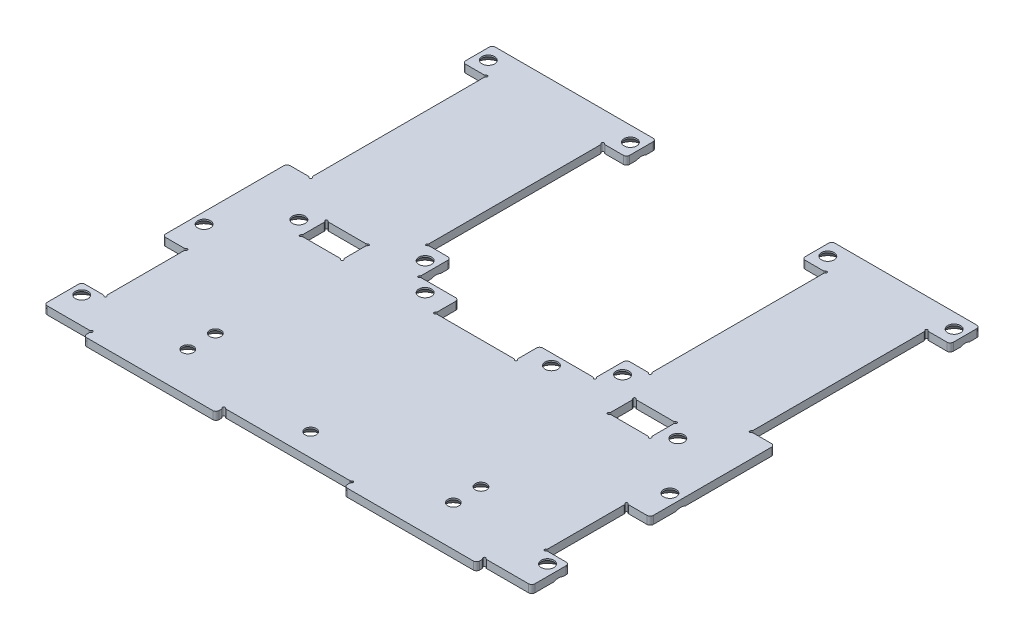
from build123d import *

# Parameters (mm, degrees)
STOCK_HAMMERSAW_START                   = 9.525
STOCK_HAMMERSAW_MULTIBODY_1_OUTLINE_R   = 2.5527
STOCK_HAMMERSAW_MULTIBODY_1_OUTLINE_R_2 = 2.2479
STOCK_HAMMERSAW_MULTIBODY_1_OUTLINE_W   = 15.875
STOCK_HAMMERSAW_MULTIBODY_1_OUTLINE_H   = 9.525
STOCK_HAMMERSAW_MULTIBODY_1_DEPTH       = 3.175
SKETCH1_W                               = 16.637
SKETCH1_H                               = 10.287
SKETCH1_W_2                             = 15.875
SKETCH1_H_2                             = 9.525
CUT_EXTRUDE1_DEPTH                      = 190.518513278
SKETCH2_R                               = 0.47625
CUT_EXTRUDE2_DEPTH                      = 189.995159983
FILLET1_R                               = 0.635
FILLET2_R                               = 1.27
CHAMFER1_SIZE                           = 2.207988314
CHAMFER1_SIZE_2                         = 2.54


# Read off the part's stored shape, not the designer's step: Stock-HammerSaw Multibody-1
with BuildPart() as part:
    # Stock-HammerSaw Multibody-1 outline → Stock-HammerSaw Multibody-1 (new body)
    with BuildSketch(Plane(origin=(0, 0, 0), x_dir=(1, 0, 0), z_dir=(0, 1, 0)).offset(STOCK_HAMMERSAW_START)):
        Polygon((38.1, 66.675), (15.875, 66.675), (15.875, 57.15), (-15.875, 57.15), (-15.875, 66.675), (-31.75, 66.675), (-31.75, 79.375), (-41.275, 79.375), (-41.275, 149.225), (-31.75, 149.225), (-31.75, 161.925), (-98.425, 161.925), (-98.425, 149.225), (-88.9, 149.225), (-88.9, 79.375), (-98.425, 79.375), (-98.425, 28.575), (-88.9, 28.575), (-88.9, -3.175), (-98.425, -3.175), (-98.425, -19.05), (-79.375, -19.05), (-79.375, -22.225), (-25.4, -22.225), (-25.4, -19.05), (25.4, -19.05), (25.4, -22.225), (79.375, -22.225), (79.375, -19.05), (98.425, -19.05), (98.425, -3.175), (88.9, -3.175), (88.9, 28.575), (98.425, 28.575), (98.425, 79.375), (88.9, 79.375), (88.9, 149.225), (98.425, 149.225), (98.425, 161.925), (38.1, 161.925), (38.1, 149.225), (47.625, 149.225), (47.625, 79.375), (38.1, 79.375), align=None)
        with Locations((-93.6625, -7.9375)):
            Circle(STOCK_HAMMERSAW_MULTIBODY_1_OUTLINE_R, mode=Mode.SUBTRACT)
        with Locations((-53.4035, -5.55244)):
            Circle(STOCK_HAMMERSAW_MULTIBODY_1_OUTLINE_R_2, mode=Mode.SUBTRACT)
        with Locations((-53.4035, 5.55244)):
            Circle(STOCK_HAMMERSAW_MULTIBODY_1_OUTLINE_R_2, mode=Mode.SUBTRACT)
        with Locations((-93.6625, 41.275)):
            Circle(STOCK_HAMMERSAW_MULTIBODY_1_OUTLINE_R, mode=Mode.SUBTRACT)
        with Locations((-76.2, 61.9125)):
            Circle(STOCK_HAMMERSAW_MULTIBODY_1_OUTLINE_R, mode=Mode.SUBTRACT)
        with Locations((-61.9125, 61.9125)):
            Rectangle(STOCK_HAMMERSAW_MULTIBODY_1_OUTLINE_W, STOCK_HAMMERSAW_MULTIBODY_1_OUTLINE_H, mode=Mode.SUBTRACT)
        with Locations((-25.4, 61.9125)):
            Circle(STOCK_HAMMERSAW_MULTIBODY_1_OUTLINE_R, mode=Mode.SUBTRACT)
        with Locations((0, -9.525)):
            Circle(STOCK_HAMMERSAW_MULTIBODY_1_OUTLINE_R_2, mode=Mode.SUBTRACT)
        with Locations((53.4035, -5.55244)):
            Circle(STOCK_HAMMERSAW_MULTIBODY_1_OUTLINE_R_2, mode=Mode.SUBTRACT)
        with Locations((93.6625, -7.9375)):
            Circle(STOCK_HAMMERSAW_MULTIBODY_1_OUTLINE_R, mode=Mode.SUBTRACT)
        with Locations((53.4035, 5.55244)):
            Circle(STOCK_HAMMERSAW_MULTIBODY_1_OUTLINE_R_2, mode=Mode.SUBTRACT)
        with Locations((25.4, 61.9125)):
            Circle(STOCK_HAMMERSAW_MULTIBODY_1_OUTLINE_R, mode=Mode.SUBTRACT)
        with Locations((93.6625, 41.275)):
            Circle(STOCK_HAMMERSAW_MULTIBODY_1_OUTLINE_R, mode=Mode.SUBTRACT)
        with Locations((61.9125, 61.9125)):
            Rectangle(STOCK_HAMMERSAW_MULTIBODY_1_OUTLINE_W, STOCK_HAMMERSAW_MULTIBODY_1_OUTLINE_H, mode=Mode.SUBTRACT)
        with Locations((76.2, 61.9125)):
            Circle(STOCK_HAMMERSAW_MULTIBODY_1_OUTLINE_R, mode=Mode.SUBTRACT)
        with Locations((-36.5125, 73.025)):
            Circle(STOCK_HAMMERSAW_MULTIBODY_1_OUTLINE_R, mode=Mode.SUBTRACT)
        with Locations((-93.6625, 155.575)):
            Circle(STOCK_HAMMERSAW_MULTIBODY_1_OUTLINE_R, mode=Mode.SUBTRACT)
        with Locations((-36.5125, 155.575)):
            Circle(STOCK_HAMMERSAW_MULTIBODY_1_OUTLINE_R, mode=Mode.SUBTRACT)
        with Locations((42.8625, 73.025)):
            Circle(STOCK_HAMMERSAW_MULTIBODY_1_OUTLINE_R, mode=Mode.SUBTRACT)
        with Locations((42.8625, 155.575)):
            Circle(STOCK_HAMMERSAW_MULTIBODY_1_OUTLINE_R, mode=Mode.SUBTRACT)
        with Locations((93.6625, 155.575)):
            Circle(STOCK_HAMMERSAW_MULTIBODY_1_OUTLINE_R, mode=Mode.SUBTRACT)
    extrude(amount=STOCK_HAMMERSAW_MULTIBODY_1_DEPTH)

    # Sketch1 → Cut-Extrude1 (cut, through all)
    # profile 1 of 3: a face of its own
    with BuildSketch(Plane(origin=(0, 12.7, 0), x_dir=(1, 0, 0), z_dir=(0, 1, 0))):
        Polygon((38.1, 66.675), (15.875, 66.675), (15.875, 57.15), (-15.875, 57.15), (-15.875, 66.675), (-31.75, 66.675), (-31.75, 79.375), (-41.275, 79.375), (-41.275, 149.225), (-31.75, 149.225), (-31.75, 161.925), (-98.425, 161.925), (-98.425, 149.225), (-88.9, 149.225), (-88.9, 79.375), (-98.425, 79.375), (-98.425, 28.575), (-88.9, 28.575), (-88.9, -3.175), (-98.425, -3.175), (-98.425, -19.05), (-79.375, -19.05), (-79.375, -22.225), (-25.4, -22.225), (-25.4, -19.05), (25.4, -19.05), (25.4, -22.225), (79.375, -22.225), (79.375, -19.05), (98.425, -19.05), (98.425, -3.175), (88.9, -3.175), (88.9, 28.575), (98.425, 28.575), (98.425, 79.375), (88.9, 79.375), (88.9, 149.225), (98.425, 149.225), (98.425, 161.925), (38.1, 161.925), (38.1, 149.225), (47.625, 149.225), (47.625, 79.375), (38.1, 79.375), align=None)
        Polygon((38.481, 66.294), (16.256, 66.294), (16.256, 56.769), (-16.256, 56.769), (-16.256, 66.294), (-32.131, 66.294), (-32.131, 78.994), (-41.656, 78.994), (-41.656, 149.606), (-32.131, 149.606), (-32.131, 161.544), (-98.044, 161.544), (-98.044, 149.606), (-88.519, 149.606), (-88.519, 78.994), (-98.044, 78.994), (-98.044, 28.956), (-88.519, 28.956), (-88.519, -3.556), (-98.044, -3.556), (-98.044, -18.669), (-78.994, -18.669), (-78.994, -21.844), (-25.781, -21.844), (-25.781, -18.669), (25.781, -18.669), (25.781, -21.844), (78.994, -21.844), (78.994, -18.669), (98.044, -18.669), (98.044, -3.556), (88.519, -3.556), (88.519, 28.956), (98.044, 28.956), (98.044, 78.994), (88.519, 78.994), (88.519, 149.606), (98.044, 149.606), (98.044, 161.544), (38.481, 161.544), (38.481, 149.606), (48.006, 149.606), (48.006, 78.994), (38.481, 78.994), align=None, mode=Mode.SUBTRACT)
    # profile 2 of 3: a face of its own
    with BuildSketch(Plane(origin=(0, 12.7, 0), x_dir=(1, 0, 0), z_dir=(0, 1, 0))):
        with Locations((-61.9125, 61.9125)):
            Rectangle(SKETCH1_W, SKETCH1_H)
        with Locations((-61.9125, 61.9125)):
            Rectangle(SKETCH1_W_2, SKETCH1_H_2, mode=Mode.SUBTRACT)
    # profile 3 of 3: a face of its own
    with BuildSketch(Plane(origin=(0, 12.7, 0), x_dir=(1, 0, 0), z_dir=(0, 1, 0))):
        with Locations((61.9125, 61.9125)):
            Rectangle(SKETCH1_W, SKETCH1_H)
        with Locations((61.9125, 61.9125)):
            Rectangle(SKETCH1_W_2, SKETCH1_H_2, mode=Mode.SUBTRACT)
    extrude(amount=-CUT_EXTRUDE1_DEPTH, mode=Mode.SUBTRACT)

    # Sketch2 → Cut-Extrude2 (cut, through all)
    with BuildSketch(Plane(origin=(0, 12.7, 0), x_dir=(1, 0, 0), z_dir=(0, 1, 0))):
        with Locations((-88.519, 149.606)):
            Circle(SKETCH2_R)
        with Locations((-41.656, 149.606)):
            Circle(SKETCH2_R)
        with Locations((-41.656, 78.994)):
            Circle(SKETCH2_R)
        with Locations((-32.131, 66.294)):
            Circle(SKETCH2_R)
        with Locations((-16.256, 56.769)):
            Circle(SKETCH2_R)
        with Locations((-88.519, 78.994)):
            Circle(SKETCH2_R)
        with Locations((-88.519, 28.956)):
            Circle(SKETCH2_R)
        with Locations((-88.519, -3.556)):
            Circle(SKETCH2_R)
        with Locations((-78.994, -18.669)):
            Circle(SKETCH2_R)
        with Locations((-25.781, -18.669)):
            Circle(SKETCH2_R)
        with Locations((25.781, -18.669)):
            Circle(SKETCH2_R)
        with Locations((78.994, -18.669)):
            Circle(SKETCH2_R)
        with Locations((88.519, -3.556)):
            Circle(SKETCH2_R)
        with Locations((88.519, 28.956)):
            Circle(SKETCH2_R)
        with Locations((88.519, 78.994)):
            Circle(SKETCH2_R)
        with Locations((48.006, 78.994)):
            Circle(SKETCH2_R)
        with Locations((38.481, 66.294)):
            Circle(SKETCH2_R)
        with Locations((16.256, 56.769)):
            Circle(SKETCH2_R)
        with Locations((48.006, 149.606)):
            Circle(SKETCH2_R)
        with Locations((88.519, 149.606)):
            Circle(SKETCH2_R)
        with Locations((70.231, 67.056)):
            Circle(SKETCH2_R)
        with Locations((70.231, 56.769)):
            Circle(SKETCH2_R)
        with Locations((53.594, 56.769)):
            Circle(SKETCH2_R)
        with Locations((53.594, 67.056)):
            Circle(SKETCH2_R)
        with Locations((-53.594, 56.769)):
            Circle(SKETCH2_R)
        with Locations((-53.594, 67.056)):
            Circle(SKETCH2_R)
        with Locations((-70.231, 67.056)):
            Circle(SKETCH2_R)
        with Locations((-70.231, 56.769)):
            Circle(SKETCH2_R)
    extrude(amount=-CUT_EXTRUDE2_DEPTH, mode=Mode.SUBTRACT)

    # Fillet1
    fillet1_edges = [part.edges().sort_by_distance(p)[0] for p in [
        (-79.47025, 11.1125, 18.669),
        (-88.519, 11.1125, 3.07975),
        (-88.99525, 11.1125, -28.956),
        (-88.519, 11.1125, -79.47025),
        (-15.77975, 11.1125, -56.769),
        (-31.65475, 11.1125, -66.294),
        (-41.17975, 11.1125, -78.994),
        (-41.656, 11.1125, -149.12975),
        (-69.75475, 11.1125, -56.769),
        (-70.231, 11.1125, -66.57975),
        (-54.07025, 11.1125, -67.056),
        (16.256, 11.1125, -57.24525),
        (47.52975, 11.1125, -149.606),
        (88.519, 11.1125, -149.12975),
        (69.75475, 11.1125, -67.056),
        (-54.07025, 11.1125, -56.769),
        (54.07025, 11.1125, -67.056),
        (54.07025, 11.1125, -56.769),
        (70.231, 11.1125, -57.24525),
        (-88.99525, 11.1125, -149.606),
        (53.594, 11.1125, -57.24525),
        (53.594, 11.1125, -66.57975),
        (69.75475, 11.1125, -56.769),
        (70.231, 11.1125, -66.57975),
        (-53.594, 11.1125, -57.24525),
        (-53.594, 11.1125, -66.57975),
        (-69.75475, 11.1125, -67.056),
        (-70.231, 11.1125, -57.24525),
        (47.52975, 11.1125, -78.994),
        (48.006, 11.1125, -149.12975),
        (88.99525, 11.1125, -149.606),
        (88.519, 11.1125, -79.47025),
        (88.99525, 11.1125, -28.956),
        (88.519, 11.1125, 3.07975),
        (79.47025, 11.1125, 18.669),
        (25.781, 11.1125, 19.14525),
        (-25.30475, 11.1125, 18.669),
        (-78.994, 11.1125, 19.14525),
        (-88.99525, 11.1125, 3.556),
        (-88.519, 11.1125, -28.47975),
        (-88.99525, 11.1125, -78.994),
        (-88.519, 11.1125, -149.12975),
        (-41.17975, 11.1125, -149.606),
        (-41.656, 11.1125, -79.47025),
        (-32.131, 11.1125, -66.77025),
        (-16.256, 11.1125, -57.24525),
        (15.77975, 11.1125, -56.769),
        (38.00475, 11.1125, -66.294),
        (38.481, 11.1125, -66.77025),
        (48.006, 11.1125, -79.47025),
        (88.99525, 11.1125, -78.994),
        (88.519, 11.1125, -28.47975),
        (88.99525, 11.1125, 3.556),
        (78.994, 11.1125, 19.14525),
        (25.30475, 11.1125, 18.669),
        (-25.781, 11.1125, 19.14525),
    ]]
    fillet(fillet1_edges, radius=FILLET1_R)

    # Fillet2
    fillet2_edges = [part.edges().sort_by_distance(p)[0] for p in [
        (38.481, 11.1125, -78.994),
        (16.256, 11.1125, -66.294),
        (-16.256, 11.1125, -66.294),
        (-32.131, 11.1125, -78.994),
        (-32.131, 11.1125, -149.606),
        (-32.131, 11.1125, -161.544),
        (-98.044, 11.1125, -161.544),
        (-98.044, 11.1125, -149.606),
        (-98.044, 11.1125, -78.994),
        (-98.044, 11.1125, -28.956),
        (-98.044, 11.1125, 3.556),
        (-98.044, 11.1125, 18.669),
        (-78.994, 11.1125, 21.844),
        (-25.781, 11.1125, 21.844),
        (25.781, 11.1125, 21.844),
        (78.994, 11.1125, 21.844),
        (98.044, 11.1125, 18.669),
        (98.044, 11.1125, 3.556),
        (98.044, 11.1125, -28.956),
        (98.044, 11.1125, -78.994),
        (98.044, 11.1125, -149.606),
        (98.044, 11.1125, -161.544),
        (38.481, 11.1125, -161.544),
        (38.481, 11.1125, -149.606),
    ]]
    fillet(fillet2_edges, radius=FILLET2_R)

    # Chamfer1
    # the kernel refuses this chamfer: 2.54, 2.207988314 mm, written as the material it takes off along each edge
    with BuildSketch(Plane(origin=(-93.6625, 9.525, -41.275), x_dir=(1, 0, 0), z_dir=(0, 0, 1))) as chamfer1_piece_1:
        Polygon((2.5527 + CHAMFER1_SIZE, 0), (2.5527, CHAMFER1_SIZE_2), (2.5527, 0), align=None)
    revolve(axis=Axis((-93.6625, 9.525, -41.275), (0, 1, 0)), mode=Mode.SUBTRACT)
    with BuildSketch(Plane(origin=(-93.6625, 9.525, 7.9375), x_dir=(1, 0, 0), z_dir=(0, 0, 1))) as chamfer1_piece_2:
        Polygon((2.5527 + CHAMFER1_SIZE, 0), (2.5527, CHAMFER1_SIZE_2), (2.5527, 0), align=None)
    revolve(axis=Axis((-93.6625, 9.525, 7.9375), (0, 1, 0)), mode=Mode.SUBTRACT)
    with BuildSketch(Plane(origin=(-53.4035, 9.525, 5.55244), x_dir=(1, 0, 0), z_dir=(0, 0, 1))) as chamfer1_piece_3:
        Polygon((2.2479 + CHAMFER1_SIZE, 0), (2.2479, CHAMFER1_SIZE_2), (2.2479, 0), align=None)
    revolve(axis=Axis((-53.4035, 9.525, 5.55244), (0, 1, 0)), mode=Mode.SUBTRACT)
    with BuildSketch(Plane(origin=(-53.4035, 9.525, -5.55244), x_dir=(1, 0, 0), z_dir=(0, 0, 1))) as chamfer1_piece_4:
        Polygon((2.2479 + CHAMFER1_SIZE, 0), (2.2479, CHAMFER1_SIZE_2), (2.2479, 0), align=None)
    revolve(axis=Axis((-53.4035, 9.525, -5.55244), (0, 1, 0)), mode=Mode.SUBTRACT)
    with BuildSketch(Plane(origin=(53.4035, 9.525, 5.55244), x_dir=(1, 0, 0), z_dir=(0, 0, 1))) as chamfer1_piece_5:
        Polygon((2.2479 + CHAMFER1_SIZE, 0), (2.2479, CHAMFER1_SIZE_2), (2.2479, 0), align=None)
    revolve(axis=Axis((53.4035, 9.525, 5.55244), (0, 1, 0)), mode=Mode.SUBTRACT)
    with BuildSketch(Plane(origin=(53.4035, 9.525, -5.55244), x_dir=(1, 0, 0), z_dir=(0, 0, 1))) as chamfer1_piece_6:
        Polygon((2.2479 + CHAMFER1_SIZE, 0), (2.2479, CHAMFER1_SIZE_2), (2.2479, 0), align=None)
    revolve(axis=Axis((53.4035, 9.525, -5.55244), (0, 1, 0)), mode=Mode.SUBTRACT)
    with BuildSketch(Plane(origin=(93.6625, 9.525, -41.275), x_dir=(1, 0, 0), z_dir=(0, 0, 1))) as chamfer1_piece_7:
        Polygon((2.5527 + CHAMFER1_SIZE, 0), (2.5527, CHAMFER1_SIZE_2), (2.5527, 0), align=None)
    revolve(axis=Axis((93.6625, 9.525, -41.275), (0, 1, 0)), mode=Mode.SUBTRACT)
    with BuildSketch(Plane(origin=(-76.2, 9.525, -61.9125), x_dir=(1, 0, 0), z_dir=(0, 0, 1))) as chamfer1_piece_8:
        Polygon((2.5527 + CHAMFER1_SIZE, 0), (2.5527, CHAMFER1_SIZE_2), (2.5527, 0), align=None)
    revolve(axis=Axis((-76.2, 9.525, -61.9125), (0, 1, 0)), mode=Mode.SUBTRACT)
    with BuildSketch(Plane(origin=(42.8625, 9.525, -155.575), x_dir=(1, 0, 0), z_dir=(0, 0, 1))) as chamfer1_piece_9:
        Polygon((2.5527 + CHAMFER1_SIZE, 0), (2.5527, CHAMFER1_SIZE_2), (2.5527, 0), align=None)
    revolve(axis=Axis((42.8625, 9.525, -155.575), (0, 1, 0)), mode=Mode.SUBTRACT)
    with BuildSketch(Plane(origin=(-36.5125, 9.525, -155.575), x_dir=(1, 0, 0), z_dir=(0, 0, 1))) as chamfer1_piece_10:
        Polygon((2.5527 + CHAMFER1_SIZE, 0), (2.5527, CHAMFER1_SIZE_2), (2.5527, 0), align=None)
    revolve(axis=Axis((-36.5125, 9.525, -155.575), (0, 1, 0)), mode=Mode.SUBTRACT)
    with BuildSketch(Plane(origin=(-93.6625, 9.525, -155.575), x_dir=(1, 0, 0), z_dir=(0, 0, 1))) as chamfer1_piece_11:
        Polygon((2.5527 + CHAMFER1_SIZE, 0), (2.5527, CHAMFER1_SIZE_2), (2.5527, 0), align=None)
    revolve(axis=Axis((-93.6625, 9.525, -155.575), (0, 1, 0)), mode=Mode.SUBTRACT)
    with BuildSketch(Plane(origin=(-25.4, 9.525, -61.9125), x_dir=(1, 0, 0), z_dir=(0, 0, 1))) as chamfer1_piece_12:
        Polygon((2.5527 + CHAMFER1_SIZE, 0), (2.5527, CHAMFER1_SIZE_2), (2.5527, 0), align=None)
    revolve(axis=Axis((-25.4, 9.525, -61.9125), (0, 1, 0)), mode=Mode.SUBTRACT)
    with BuildSketch(Plane(origin=(93.6625, 9.525, 7.9375), x_dir=(1, 0, 0), z_dir=(0, 0, 1))) as chamfer1_piece_13:
        Polygon((2.5527 + CHAMFER1_SIZE, 0), (2.5527, CHAMFER1_SIZE_2), (2.5527, 0), align=None)
    revolve(axis=Axis((93.6625, 9.525, 7.9375), (0, 1, 0)), mode=Mode.SUBTRACT)
    with BuildSketch(Plane(origin=(42.8625, 9.525, -73.025), x_dir=(1, 0, 0), z_dir=(0, 0, 1))) as chamfer1_piece_14:
        Polygon((2.5527 + CHAMFER1_SIZE, 0), (2.5527, CHAMFER1_SIZE_2), (2.5527, 0), align=None)
    revolve(axis=Axis((42.8625, 9.525, -73.025), (0, 1, 0)), mode=Mode.SUBTRACT)
    with BuildSketch(Plane(origin=(-36.5125, 9.525, -73.025), x_dir=(1, 0, 0), z_dir=(0, 0, 1))) as chamfer1_piece_15:
        Polygon((2.5527 + CHAMFER1_SIZE, 0), (2.5527, CHAMFER1_SIZE_2), (2.5527, 0), align=None)
    revolve(axis=Axis((-36.5125, 9.525, -73.025), (0, 1, 0)), mode=Mode.SUBTRACT)
    with BuildSketch(Plane(origin=(93.6625, 9.525, -155.575), x_dir=(1, 0, 0), z_dir=(0, 0, 1))) as chamfer1_piece_16:
        Polygon((2.5527 + CHAMFER1_SIZE, 0), (2.5527, CHAMFER1_SIZE_2), (2.5527, 0), align=None)
    revolve(axis=Axis((93.6625, 9.525, -155.575), (0, 1, 0)), mode=Mode.SUBTRACT)
    with BuildSketch(Plane(origin=(76.2, 9.525, -61.9125), x_dir=(1, 0, 0), z_dir=(0, 0, 1))) as chamfer1_piece_17:
        Polygon((2.5527 + CHAMFER1_SIZE, 0), (2.5527, CHAMFER1_SIZE_2), (2.5527, 0), align=None)
    revolve(axis=Axis((76.2, 9.525, -61.9125), (0, 1, 0)), mode=Mode.SUBTRACT)
    with BuildSketch(Plane(origin=(0, 9.525, 9.525), x_dir=(1, 0, 0), z_dir=(0, 0, 1))) as chamfer1_piece_18:
        Polygon((2.2479 + CHAMFER1_SIZE, 0), (2.2479, CHAMFER1_SIZE_2), (2.2479, 0), align=None)
    revolve(axis=Axis((0, 9.525, 9.525), (0, 1, 0)), mode=Mode.SUBTRACT)
    with BuildSketch(Plane(origin=(25.4, 9.525, -61.9125), x_dir=(1, 0, 0), z_dir=(0, 0, 1))) as chamfer1_piece_19:
        Polygon((2.5527 + CHAMFER1_SIZE, 0), (2.5527, CHAMFER1_SIZE_2), (2.5527, 0), align=None)
    revolve(axis=Axis((25.4, 9.525, -61.9125), (0, 1, 0)), mode=Mode.SUBTRACT)


solid = part.part
